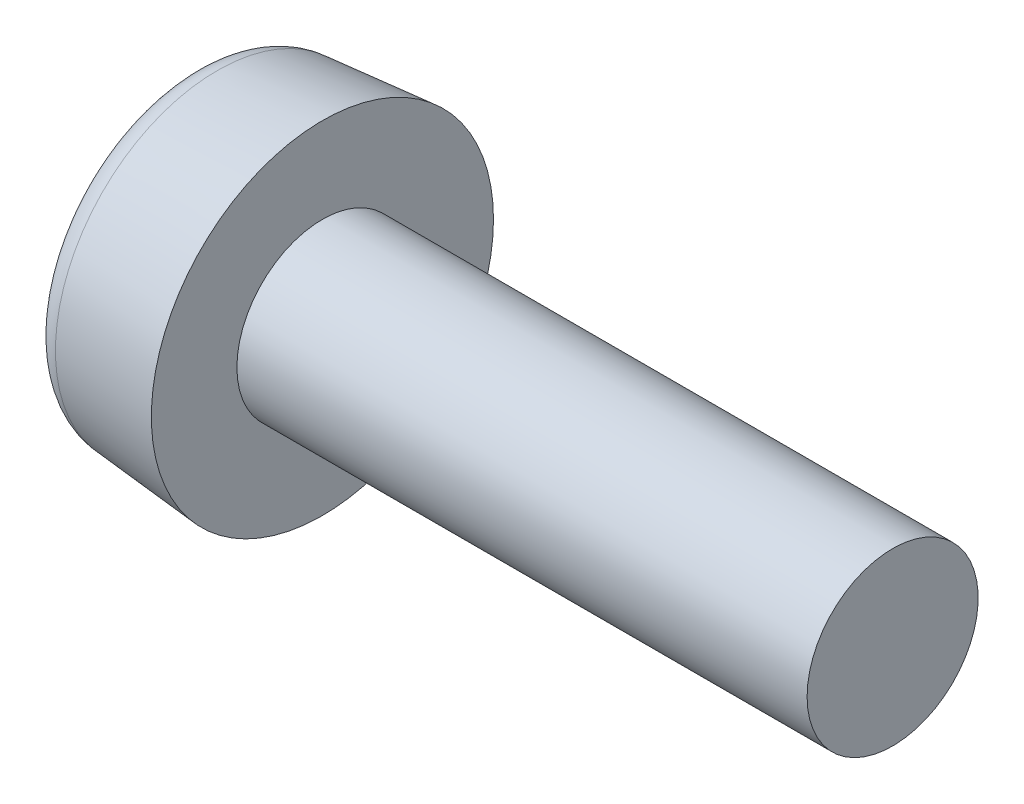
from build123d import *

# Parameters (mm, degrees)
SKETCH1_R      = 6
BASEHEAD_DEPTH = 4.6
BASEHEAD_DRAFT = -5
SKETCH8_W      = 20
SKETCH8_H      = 3
SOCKET_DEPTH   = 2
HEADFILLET2_R  = 1


with BuildPart() as part:
    # Sketch1 → BaseHead (with draft: the straight prism first)
    with BuildSketch(Plane(origin=(4.6, 0, 0), x_dir=(0, 0, -1), z_dir=(1, 0, 0))):
        Circle(SKETCH1_R)
    extrude(amount=-BASEHEAD_DEPTH)
    # BaseHead: the draft: its side faces are tilted about the plane it starts from
    basehead_sides = [part.faces().sort_by_distance(p)[0] for p in [
        (2.3, 0, 6),
    ]]
    draft(basehead_sides, Plane(origin=(4.6, 0, 0), x_dir=(0, 0, -1), z_dir=(1, 0, 0)), BASEHEAD_DRAFT)

    # Sketch8 → Revolve1 (revolve)
    with BuildSketch(Plane.XY):
        with Locations((14.6, 1.5)):
            Rectangle(SKETCH8_W, SKETCH8_H)
    revolve(axis=Axis((0, 0, 0), (1, 0, 0)))

    # Sketch4 → Socket (cut)
    with BuildSketch(Plane(origin=(0, 0, 0), x_dir=(0, 0, -1), z_dir=(1, 0, 0))):
        with BuildLine():
            add(Edge.make_bspline(
                [(1, 1.732050808), (1.384615385, 1.509993012), (2.307692308, 1.332346775), (1.846153846, 0), (2.307692308, -1.332346775), (0.923076923, -1.59881613), (0, -2.66469355), (-0.923076923, -1.59881613), (-2.307692308, -1.332346775), (-1.846153846, 0), (-2.307692308, 1.332346775), (-0.923076923, 1.59881613), (0, 2.66469355), (0.615384615, 1.954108603), (1, 1.732050808)],
                knots=[0, 0, 0, 0, 0.083333333, 0.166666667, 0.25, 0.333333333, 0.416666667, 0.5, 0.583333333, 0.666666667, 0.75, 0.833333333, 0.916666667, 1, 1, 1, 1], degree=3))
        make_face()
    extrude(amount=SOCKET_DEPTH, mode=Mode.SUBTRACT)

    # Sketch5 → Cut-Loft1 section 0
    with BuildSketch(Plane.ZY.offset(-2), mode=Mode.PRIVATE) as cut_loft1_s0:
        with BuildLine():
            add(Edge.make_bspline(
                [(-1, 1.732050808), (-1.384615385, 1.509993012), (-2.307692308, 1.332346775), (-1.846153846, 0), (-2.307692308, -1.332346775), (-0.923076923, -1.59881613), (0, -2.66469355), (0.923076923, -1.59881613), (2.307692308, -1.332346775), (1.846153846, 0), (2.307692308, 1.332346775), (0.923076923, 1.59881613), (0, 2.66469355), (-0.615384615, 1.954108603), (-1, 1.732050808)],
                knots=[0, 0, 0, 0, 0.083333333, 0.166666667, 0.25, 0.333333333, 0.416666667, 0.5, 0.583333333, 0.666666667, 0.75, 0.833333333, 0.916666667, 1, 1, 1, 1], degree=3))
        make_face()
    loft([Vertex(2.666666667, 0, 0), cut_loft1_s0.sketch], mode=Mode.SUBTRACT)

    # HeadFillet2
    headfillet2_edges = [part.edges().sort_by_distance(p)[0] for p in [
        (0, 0, 5.597552148),
    ]]
    fillet(headfillet2_edges, radius=HEADFILLET2_R)


solid = part.part
